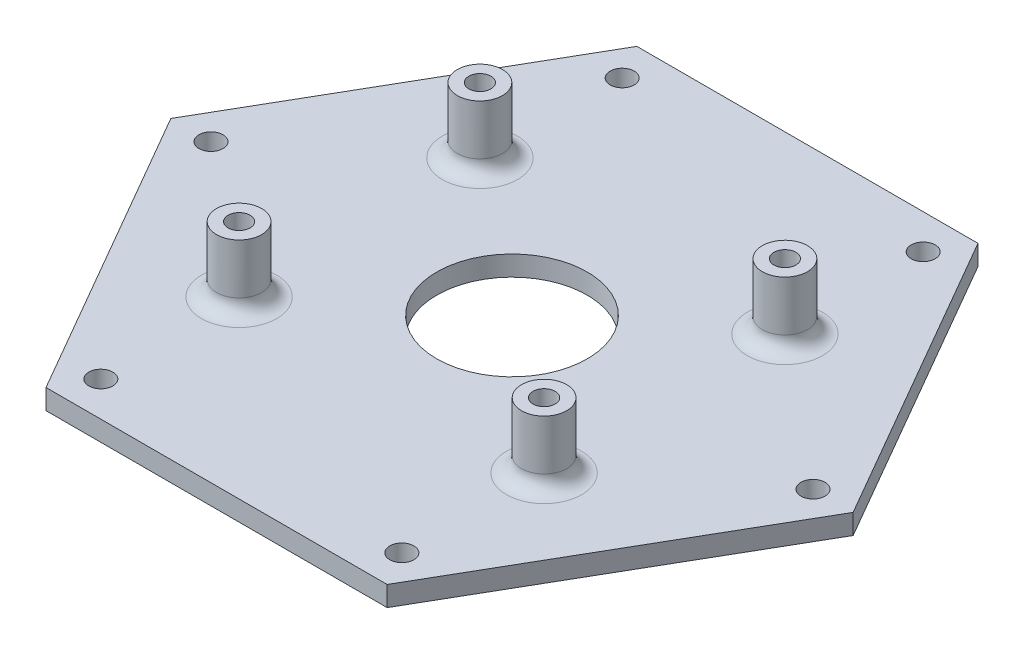
from build123d import *

# Parameters (mm, degrees)
BOSS_EXTRUDE1_DEPTH = 2
SKETCH2_R           = 2.25
BOSS_EXTRUDE2_DEPTH = 6.5
SKETCH3_R           = 1.1
CUT_EXTRUDE1_DEPTH  = 46.773900861
SKETCH4_R           = 7.5
CUT_EXTRUDE2_DEPTH  = 46.44502173
SKETCH6_R           = 1.2
CUT_EXTRUDE3_DEPTH  = 46.44502173
CIRPATTERN1_COUNT   = 6
FILLET2_R           = 1.5


with BuildPart() as part:
    # Sketch1 → Boss-Extrude1 (new body)
    with BuildSketch(Plane(origin=(0, 0, 0), x_dir=(1, 0, 0), z_dir=(0, 1, 0))):
        Polygon((34, 0), (17, 29.444863729), (-17, 29.444863729), (-34, 0), (-17, -29.444863729), (17, -29.444863729), align=None)
    extrude(amount=BOSS_EXTRUDE1_DEPTH)

    # Sketch2 → Boss-Extrude2 (add)
    with BuildSketch(Plane(origin=(0, 2, 0), x_dir=(1, 0, 0), z_dir=(0, 1, 0))):
        with Locations((-15.2, 12)):
            Circle(SKETCH2_R)
        with Locations((15.2, 12)):
            Circle(SKETCH2_R)
        with Locations((-15.2, -12)):
            Circle(SKETCH2_R)
        with Locations((15.2, -12)):
            Circle(SKETCH2_R)
    extrude(amount=BOSS_EXTRUDE2_DEPTH)

    # Sketch3 → Cut-Extrude1 (cut, through all)
    with BuildSketch(Plane(origin=(0, 8.5, 0), x_dir=(1, 0, 0), z_dir=(0, 1, 0))):
        with Locations((-15.2, 12)):
            Circle(SKETCH3_R)
        with Locations((15.2, 12)):
            Circle(SKETCH3_R)
        with Locations((15.2, -12)):
            Circle(SKETCH3_R)
        with Locations((-15.2, -12)):
            Circle(SKETCH3_R)
    extrude(amount=-CUT_EXTRUDE1_DEPTH, mode=Mode.SUBTRACT)

    # Sketch4 → Cut-Extrude2 (cut, through all)
    with BuildSketch(Plane(origin=(0, 2, 0), x_dir=(1, 0, 0), z_dir=(0, 1, 0))):
        Circle(SKETCH4_R)
    extrude(amount=-CUT_EXTRUDE2_DEPTH, mode=Mode.SUBTRACT)

    # Sketch6 → Cut-Extrude3 (cut, through all)
    with BuildSketch(Plane(origin=(0, 2, 0), x_dir=(1, 0, 0), z_dir=(0, 1, 0))):
        with Locations((-30, 0)):
            Circle(SKETCH6_R)
    cut_extrude3 = extrude(amount=-CUT_EXTRUDE3_DEPTH, mode=Mode.SUBTRACT)

    # CirPattern1: Cut-Extrude3 ×6 about axis
    cirpattern1_axis = Axis((0, 0, 0), (0, 1, 0))
    for i in range(1, CIRPATTERN1_COUNT):
        add(cut_extrude3.rotate(cirpattern1_axis, i * 360 / CIRPATTERN1_COUNT), mode=Mode.SUBTRACT)

    # Fillet2
    fillet2_edges = [part.edges().sort_by_distance(p)[0] for p in [
        (12.95, 2, -12),
        (-17.45, 2, -12),
        (12.95, 2, 12),
        (-17.45, 2, 12),
    ]]
    fillet(fillet2_edges, radius=FILLET2_R)


solid = part.part
